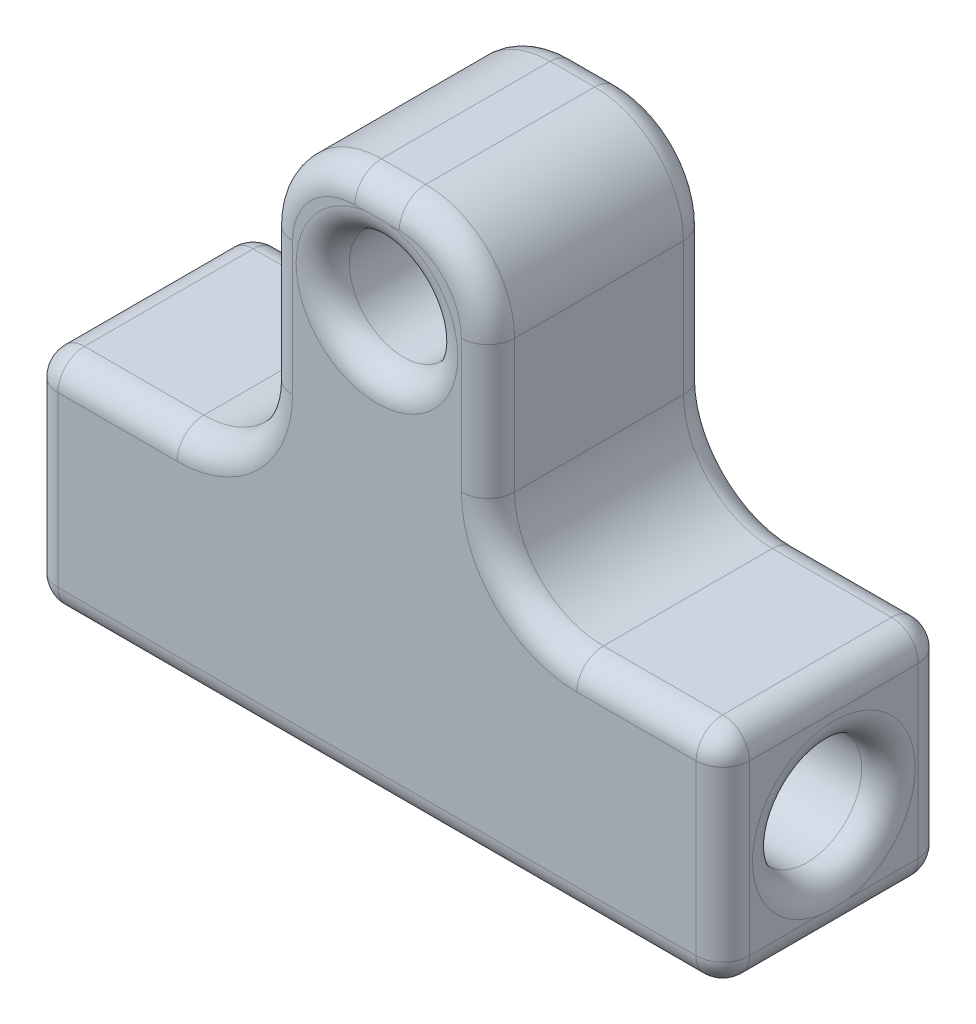
from build123d import *

# Parameters (mm, degrees)
SKETCH1_R           = 6.1
BOSS_EXTRUDE1_DEPTH = 25
SKETCH2_R           = 6.15
CUT_EXTRUDE1_DEPTH  = 88.09658729287669
FILLET1_R           = 3


with BuildPart() as part:
    # Sketch1 → Boss-Extrude1 (new body)
    with BuildSketch(Plane.XY):
        with BuildLine():
            Line((22.500000000000078, -5.000000000000004), (38.925619834710695, -5.000000000000004))
            Line((38.925619834710695, -5.000000000000004), (38.925619834710695, -30.000000000000007))
            Line((38.925619834710695, -30.000000000000007), (-38.92561983471068, -30.000000000000007))
            Line((-38.92561983471068, -30.000000000000007), (-38.92561983471068, -5.000000000000004))
            Line((-38.92561983471068, -5.000000000000004), (-22.500000000000068, -5.000000000000004))
            ThreePointArc((-22.500000000000068, -5.000000000000004), (-15.42893218813452, -2.0710678118654817), (-12.499999999999995, 5.000000000000067))
            Line((-12.499999999999995, 5.000000000000067), (-12.499999999999998, 19.99999999999993))
            ThreePointArc((-12.499999999999998, 19.99999999999993), (-9.571067811865476, 27.071067811865476), (-2.4999999999999294, 30))
            Line((-2.4999999999999294, 30), (2.499999999999931, 30))
            ThreePointArc((2.499999999999931, 30), (9.571067811865479, 27.071067811865476), (12.500000000000002, 19.99999999999993))
            Line((12.500000000000002, 19.99999999999993), (12.500000000000005, 5.000000000000065))
            ThreePointArc((12.500000000000005, 5.000000000000065), (15.428932188134532, -2.0710678118654826), (22.500000000000078, -5.000000000000004))
        make_face()
        with Locations((3.04e-15, 18)):
            Circle(SKETCH1_R, mode=Mode.SUBTRACT)
    extrude(amount=BOSS_EXTRUDE1_DEPTH)

    # Sketch2 → Cut-Extrude1 (cut, through all)
    with BuildSketch(Plane(origin=(38.925619834710695, 0, 0), x_dir=(0, 0, -1), z_dir=(1, 0, 0))):
        with Locations((-12.499999999999998, -18.000000000000007)):
            Circle(SKETCH2_R)
    extrude(amount=-CUT_EXTRUDE1_DEPTH, mode=Mode.SUBTRACT)

    # Fillet1
    # the kernel refuses this fillet: 3 mm, written as the material it takes off along each edge
    with BuildSketch(Plane(origin=(-35.92561983471068, -8.000000000000004, 22), x_dir=(0, 1, 0), z_dir=(-1, 0, 0))) as fillet1_piece_1_section:
        Polygon((0, 0), (FILLET1_R, 0), (FILLET1_R, -FILLET1_R), (0, -FILLET1_R), align=None)
    fillet1_piece_1 = extrude(amount=FILLET1_R, mode=Mode.PRIVATE)
    fillet1_piece_1 = fillet1_piece_1 - Plane(origin=(-35.92561983471068, -8.000000000000004, 22), x_dir=(0, -0.7071067811865475, -0.7071067811865475), z_dir=(-1, 0, 0)) * Sphere(FILLET1_R, mode=Mode.PRIVATE)
    add(fillet1_piece_1, mode=Mode.SUBTRACT)
    with BuildSketch(Plane(origin=(35.925619834710695, -8.000000000000004, 3), x_dir=(1, 0, 0), z_dir=(0, 1, 0))) as fillet1_piece_2_section:
        Polygon((0, 0), (FILLET1_R, 0), (FILLET1_R, FILLET1_R), (0, FILLET1_R), align=None)
    fillet1_piece_2 = extrude(amount=FILLET1_R, mode=Mode.PRIVATE)
    fillet1_piece_2 = fillet1_piece_2 - Plane(origin=(35.925619834710695, -8.000000000000004, 3), x_dir=(-0.7071067811865475, 0, 0.7071067811865475), z_dir=(0, 1, 0)) * Sphere(FILLET1_R, mode=Mode.PRIVATE)
    add(fillet1_piece_2, mode=Mode.SUBTRACT)
    with BuildSketch(Plane(origin=(-35.92561983471068, -27.000000000000007, 22), x_dir=(0, 0, 1), z_dir=(-1, 0, 0))) as fillet1_piece_3_section:
        Polygon((0, 0), (FILLET1_R, 0), (FILLET1_R, -FILLET1_R), (0, -FILLET1_R), align=None)
    fillet1_piece_3 = extrude(amount=FILLET1_R, mode=Mode.PRIVATE)
    fillet1_piece_3 = fillet1_piece_3 - Plane(origin=(-35.92561983471068, -27.000000000000007, 22), x_dir=(0, 0.7071067811865475, -0.7071067811865475), z_dir=(-1, 0, 0)) * Sphere(FILLET1_R, mode=Mode.PRIVATE)
    add(fillet1_piece_3, mode=Mode.SUBTRACT)
    with BuildSketch(Plane(origin=(35.925619834710695, -27.000000000000007, 3), x_dir=(0, 0, -1), z_dir=(1, 0, 0))) as fillet1_piece_4_section:
        Polygon((0, 0), (FILLET1_R, 0), (FILLET1_R, -FILLET1_R), (0, -FILLET1_R), align=None)
    fillet1_piece_4 = extrude(amount=FILLET1_R, mode=Mode.PRIVATE)
    fillet1_piece_4 = fillet1_piece_4 - Plane(origin=(35.925619834710695, -27.000000000000007, 3), x_dir=(0, 0.7071067811865475, 0.7071067811865475), z_dir=(1, 0, 0)) * Sphere(FILLET1_R, mode=Mode.PRIVATE)
    add(fillet1_piece_4, mode=Mode.SUBTRACT)
    with BuildSketch(Plane(origin=(-35.92561983471068, -27.000000000000007, 3), x_dir=(0, 0, -1), z_dir=(-1, 0, 0))) as fillet1_piece_5_section:
        Polygon((0, 0), (FILLET1_R, 0), (FILLET1_R, FILLET1_R), (0, FILLET1_R), align=None)
    fillet1_piece_5 = extrude(amount=FILLET1_R, mode=Mode.PRIVATE)
    fillet1_piece_5 = fillet1_piece_5 - Plane(origin=(-35.92561983471068, -27.000000000000007, 3), x_dir=(0, 0.7071067811865475, 0.7071067811865475), z_dir=(-1, 0, 0)) * Sphere(FILLET1_R, mode=Mode.PRIVATE)
    add(fillet1_piece_5, mode=Mode.SUBTRACT)
    with BuildSketch(Plane(origin=(-35.92561983471068, -8.000000000000004, 3), x_dir=(0, 1, 0), z_dir=(-1, 0, 0))) as fillet1_piece_6_section:
        Polygon((0, 0), (FILLET1_R, 0), (FILLET1_R, FILLET1_R), (0, FILLET1_R), align=None)
    fillet1_piece_6 = extrude(amount=FILLET1_R, mode=Mode.PRIVATE)
    fillet1_piece_6 = fillet1_piece_6 - Plane(origin=(-35.92561983471068, -8.000000000000004, 3), x_dir=(0, -0.7071067811865475, 0.7071067811865475), z_dir=(-1, 0, 0)) * Sphere(FILLET1_R, mode=Mode.PRIVATE)
    add(fillet1_piece_6, mode=Mode.SUBTRACT)
    with BuildSketch(Plane(origin=(35.925619834710695, -27.000000000000007, 22), x_dir=(0, 0, 1), z_dir=(1, 0, 0))) as fillet1_piece_7_section:
        Polygon((0, 0), (FILLET1_R, 0), (FILLET1_R, FILLET1_R), (0, FILLET1_R), align=None)
    fillet1_piece_7 = extrude(amount=FILLET1_R, mode=Mode.PRIVATE)
    fillet1_piece_7 = fillet1_piece_7 - Plane(origin=(35.925619834710695, -27.000000000000007, 22), x_dir=(0, 0.7071067811865475, -0.7071067811865475), z_dir=(1, 0, 0)) * Sphere(FILLET1_R, mode=Mode.PRIVATE)
    add(fillet1_piece_7, mode=Mode.SUBTRACT)
    with BuildSketch(Plane(origin=(35.925619834710695, -8.000000000000004, 22), x_dir=(1, 0, 0), z_dir=(0, 1, 0))) as fillet1_piece_8_section:
        Polygon((0, 0), (FILLET1_R, 0), (FILLET1_R, -FILLET1_R), (0, -FILLET1_R), align=None)
    fillet1_piece_8 = extrude(amount=FILLET1_R, mode=Mode.PRIVATE)
    fillet1_piece_8 = fillet1_piece_8 - Plane(origin=(35.925619834710695, -8.000000000000004, 22), x_dir=(-0.7071067811865475, 0, -0.7071067811865475), z_dir=(0, 1, 0)) * Sphere(FILLET1_R, mode=Mode.PRIVATE)
    add(fillet1_piece_8, mode=Mode.SUBTRACT)
    with BuildSketch(Plane(origin=(-35.92561983471068, -5.000000000000004, 25), x_dir=(0, -1, 0), z_dir=(1, 0, 0))) as fillet1_piece_9:
        with BuildLine():
            CenterArc((FILLET1_R, FILLET1_R), FILLET1_R, 180, 90)
            Line((-8.9e-16, FILLET1_R), (0, 0))
            Line((0, 0), (FILLET1_R, 0))
        make_face()
    extrude(amount=13.425619834710613, mode=Mode.SUBTRACT)
    with BuildSketch(Plane(origin=(-2.499999999999999, 20, 0), x_dir=(-1, -7.11e-15, 0), z_dir=(7.11e-15, -1, 0))) as fillet1_piece_10:
        with BuildLine():
            CenterArc((10 - FILLET1_R, -FILLET1_R), FILLET1_R, 8.48e-15, 90)
            Line((10, -FILLET1_R), (10, 0))
            Line((10, 0), (10 - FILLET1_R, 0))
        make_face()
    revolve(axis=Axis((-2.499999999999999, 20, 0), (0, 0, -1)), revolution_arc=90.00000000000081, mode=Mode.SUBTRACT)
    with BuildSketch(Plane(origin=(-2.4999999999999294, 30, 0), x_dir=(0, -1, 0), z_dir=(1, 0, 0))) as fillet1_piece_11:
        with BuildLine():
            CenterArc((FILLET1_R, -FILLET1_R), FILLET1_R, 90, 90)
            Line((0, -FILLET1_R), (0, 0))
            Line((0, 0), (FILLET1_R, 0))
        make_face()
    extrude(amount=4.999999999999861, mode=Mode.SUBTRACT)
    with BuildSketch(Plane(origin=(2.500000000000006, 20.000000000000007, 0), x_dir=(-7.51e-15, 1, 0), z_dir=(-1, -7.51e-15, 0))) as fillet1_piece_12:
        with BuildLine():
            CenterArc((9.999999999999993 - FILLET1_R, -FILLET1_R), FILLET1_R, 8.48e-15, 90)
            Line((9.999999999999993, -FILLET1_R), (9.999999999999993, 0))
            Line((9.999999999999993, 0), (9.999999999999993 - FILLET1_R, 0))
        make_face()
    revolve(axis=Axis((2.500000000000006, 20.000000000000007, 0), (0, 0, -1)), revolution_arc=90.00000000000088, mode=Mode.SUBTRACT)
    with BuildSketch(Plane(origin=(12.500000000000002, 19.99999999999993, 0), x_dir=(-1, -2.4e-16, 0), z_dir=(2.4e-16, -1, 0))) as fillet1_piece_13:
        with BuildLine():
            CenterArc((FILLET1_R, -FILLET1_R), FILLET1_R, 90, 90)
            Line((0, -FILLET1_R), (0, 0))
            Line((0, 0), (FILLET1_R, 0))
        make_face()
    extrude(amount=14.999999999999865, mode=Mode.SUBTRACT)
    with BuildSketch(Plane(origin=(22.500000000000004, 4.999999999999995, 0), x_dir=(-1, 7.02e-15, 0), z_dir=(7.02e-15, 1, 0))) as fillet1_piece_14:
        with BuildLine():
            CenterArc((9.999999999999998 + FILLET1_R, FILLET1_R), FILLET1_R, 180, 90)
            Line((9.999999999999998 + FILLET1_R, -4.4e-16), (9.999999999999998, 0))
            Line((9.999999999999998, 0), (9.999999999999998, FILLET1_R))
        make_face()
    revolve(axis=Axis((22.500000000000004, 4.999999999999995, 0), (0, 0, 1)), revolution_arc=90.00000000000082, mode=Mode.SUBTRACT)
    with BuildSketch(Plane(origin=(22.500000000000078, -5.000000000000004, 0), x_dir=(0, 3e-16, 1), z_dir=(1, 0, 0))) as fillet1_piece_15:
        with BuildLine():
            CenterArc((FILLET1_R, FILLET1_R), FILLET1_R, 180, 90)
            Line((-1.33e-15, FILLET1_R), (0, 0))
            Line((0, 0), (FILLET1_R, 0))
        make_face()
    extrude(amount=13.425619834710616, mode=Mode.SUBTRACT)
    with BuildSketch(Plane(origin=(-38.92561983471068, -27.000000000000007, 25), x_dir=(1, 0, 0), z_dir=(0, 1, 0))) as fillet1_piece_16:
        with BuildLine():
            CenterArc((FILLET1_R, FILLET1_R), FILLET1_R, 180, 90)
            Line((0, FILLET1_R), (0, 0))
            Line((0, 0), (FILLET1_R, 0))
        make_face()
    extrude(amount=19.000000000000004, mode=Mode.SUBTRACT)
    with BuildSketch(Plane(origin=(38.925619834710695, -8.000000000000004, 0), x_dir=(0, 0, 1), z_dir=(0, -1, 0))) as fillet1_piece_17:
        with BuildLine():
            CenterArc((FILLET1_R, FILLET1_R), FILLET1_R, 180, 90)
            Line((-4.4e-16, FILLET1_R), (0, 0))
            Line((0, 0), (FILLET1_R, 0))
        make_face()
    extrude(amount=19.000000000000004, mode=Mode.SUBTRACT)
    with BuildSketch(Plane(origin=(35.925619834710695, -30.000000000000007, 0), x_dir=(0, 1, 0), z_dir=(-1, 0, 0))) as fillet1_piece_18:
        with BuildLine():
            CenterArc((FILLET1_R, -FILLET1_R), FILLET1_R, 90, 90)
            Line((0, -FILLET1_R), (0, 0))
            Line((0, 0), (FILLET1_R, 0))
        make_face()
    extrude(amount=71.85123966942137, mode=Mode.SUBTRACT)
    with BuildSketch(Plane(origin=(-38.92561983471068, -27.000000000000007, 0), x_dir=(1, 0, 0), z_dir=(0, 1, 0))) as fillet1_piece_19:
        with BuildLine():
            CenterArc((FILLET1_R, -FILLET1_R), FILLET1_R, 90, 90)
            Line((0, -FILLET1_R), (0, 0))
            Line((0, 0), (FILLET1_R, 0))
        make_face()
    extrude(amount=19.000000000000004, mode=Mode.SUBTRACT)
    with BuildSketch(Plane(origin=(-35.92561983471068, -5.000000000000004, 0), x_dir=(0, -1, 0), z_dir=(1, 0, 0))) as fillet1_piece_20:
        with BuildLine():
            CenterArc((FILLET1_R, -FILLET1_R), FILLET1_R, 90, 90)
            Line((-8.9e-16, -FILLET1_R), (0, 0))
            Line((0, 0), (FILLET1_R, 0))
        make_face()
    extrude(amount=13.425619834710613, mode=Mode.SUBTRACT)
    with BuildSketch(Plane(origin=(-22.499999999999993, 4.999999999999993, 0), x_dir=(-7.46e-15, -1, 0), z_dir=(-1, 7.46e-15, 0))) as fillet1_piece_21:
        with BuildLine():
            CenterArc((9.999999999999998 + FILLET1_R, FILLET1_R), FILLET1_R, 180, 90)
            Line((9.999999999999998, FILLET1_R), (9.999999999999998, 0))
            Line((9.999999999999998, 0), (9.999999999999998 + FILLET1_R, 0))
        make_face()
    revolve(axis=Axis((-22.499999999999993, 4.999999999999993, 0), (0, 0, 1)), revolution_arc=90.00000000000085, mode=Mode.SUBTRACT)
    with BuildSketch(Plane(origin=(-12.499999999999995, 5.000000000000067, 0), x_dir=(1, 2.4e-16, 0), z_dir=(-2.4e-16, 1, 0))) as fillet1_piece_22:
        with BuildLine():
            CenterArc((FILLET1_R, -FILLET1_R), FILLET1_R, 90, 90)
            Line((0, -FILLET1_R), (0, 0))
            Line((0, 0), (FILLET1_R, 0))
        make_face()
    extrude(amount=14.999999999999861, mode=Mode.SUBTRACT)
    with BuildSketch(Plane(origin=(35.925619834710695, -30.000000000000007, 25), x_dir=(0, 1, 0), z_dir=(-1, 0, 0))) as fillet1_piece_23:
        with BuildLine():
            CenterArc((FILLET1_R, FILLET1_R), FILLET1_R, 180, 90)
            Line((0, FILLET1_R), (0, 0))
            Line((0, 0), (FILLET1_R, 0))
        make_face()
    extrude(amount=71.85123966942137, mode=Mode.SUBTRACT)
    with BuildSketch(Plane(origin=(38.925619834710695, -8.000000000000004, 25), x_dir=(0, 0, -1), z_dir=(0, -1, 0))) as fillet1_piece_24:
        with BuildLine():
            CenterArc((FILLET1_R, -FILLET1_R), FILLET1_R, 90, 90)
            Line((0, -FILLET1_R), (0, 0))
            Line((0, 0), (FILLET1_R, 0))
        make_face()
    extrude(amount=19.000000000000004, mode=Mode.SUBTRACT)
    with BuildSketch(Plane(origin=(38.925619834710695, -5.000000000000004, 3), x_dir=(-1, 3e-16, 0), z_dir=(0, 0, 1))) as fillet1_piece_25:
        with BuildLine():
            CenterArc((FILLET1_R, FILLET1_R), FILLET1_R, 180, 90)
            Line((-8.9e-16, FILLET1_R), (0, 0))
            Line((0, 0), (FILLET1_R, 0))
        make_face()
    extrude(amount=19, mode=Mode.SUBTRACT)
    with BuildSketch(Plane(origin=(38.925619834710695, -30.000000000000007, 3), x_dir=(0, 1, 0), z_dir=(0, 0, 1))) as fillet1_piece_26:
        with BuildLine():
            CenterArc((FILLET1_R, FILLET1_R), FILLET1_R, 180, 90)
            Line((0, FILLET1_R), (0, 0))
            Line((0, 0), (FILLET1_R, 0))
        make_face()
    extrude(amount=19, mode=Mode.SUBTRACT)
    with BuildSketch(Plane(origin=(-38.92561983471068, -30.000000000000007, 3), x_dir=(1, 0, 0), z_dir=(0, 0, 1))) as fillet1_piece_27:
        with BuildLine():
            CenterArc((FILLET1_R, FILLET1_R), FILLET1_R, 180, 90)
            Line((0, FILLET1_R), (0, 0))
            Line((0, 0), (FILLET1_R, 0))
        make_face()
    extrude(amount=19, mode=Mode.SUBTRACT)
    with BuildSketch(Plane(origin=(-38.92561983471068, -5.000000000000004, 3), x_dir=(0, -1, 0), z_dir=(0, 0, 1))) as fillet1_piece_28:
        with BuildLine():
            CenterArc((FILLET1_R, FILLET1_R), FILLET1_R, 180, 90)
            Line((-8.9e-16, FILLET1_R), (0, 0))
            Line((0, 0), (FILLET1_R, 0))
        make_face()
    extrude(amount=19, mode=Mode.SUBTRACT)
    with BuildSketch(Plane(origin=(22.500000000000078, -5.000000000000004, 25), x_dir=(0, 3e-16, -1), z_dir=(1, 0, 0))) as fillet1_piece_29:
        with BuildLine():
            CenterArc((FILLET1_R, -FILLET1_R), FILLET1_R, 89.99999999999999, 90.00000000000001)
            Line((-8.9e-16, -FILLET1_R), (0, 0))
            Line((0, 0), (FILLET1_R, 0))
        make_face()
    extrude(amount=13.425619834710616, mode=Mode.SUBTRACT)
    with BuildSketch(Plane(origin=(22.500000000000004, 4.999999999999995, 25), x_dir=(-1, 7.02e-15, 0), z_dir=(7.02e-15, 1, 0))) as fillet1_piece_30:
        with BuildLine():
            CenterArc((9.999999999999998 + FILLET1_R, -FILLET1_R), FILLET1_R, 90, 90)
            Line((9.999999999999998 + FILLET1_R, 0), (9.999999999999998, 0))
            Line((9.999999999999998, 0), (9.999999999999998, -FILLET1_R))
        make_face()
    revolve(axis=Axis((22.500000000000004, 4.999999999999995, 25), (0, 0, 1)), revolution_arc=90.00000000000082, mode=Mode.SUBTRACT)
    with BuildSketch(Plane(origin=(12.500000000000002, 19.99999999999993, 25), x_dir=(-1, -2.4e-16, 0), z_dir=(2.4e-16, -1, 0))) as fillet1_piece_31:
        with BuildLine():
            CenterArc((FILLET1_R, FILLET1_R), FILLET1_R, 180, 90)
            Line((0, FILLET1_R), (0, 0))
            Line((0, 0), (FILLET1_R, 0))
        make_face()
    extrude(amount=14.999999999999865, mode=Mode.SUBTRACT)
    with BuildSketch(Plane(origin=(3.04e-15, 18, 0), x_dir=(1, 0, 0), z_dir=(0, -1, 0))) as fillet1_piece_32:
        with BuildLine():
            CenterArc((6.1 + FILLET1_R, FILLET1_R), FILLET1_R, 180, 90)
            Line((6.099999999999999, FILLET1_R), (6.1, 0))
            Line((6.1, 0), (6.1 + FILLET1_R, 0))
        make_face()
    revolve(axis=Axis((3.04e-15, 18, 0), (0, 0, 1)), mode=Mode.SUBTRACT)
    with BuildSketch(Plane(origin=(3.04e-15, 18, 25), x_dir=(1, 0, 0), z_dir=(0, -1, 0))) as fillet1_piece_33:
        with BuildLine():
            CenterArc((6.1 + FILLET1_R, -FILLET1_R), FILLET1_R, 90, 90)
            Line((6.099999999999999, -FILLET1_R), (6.1, 0))
            Line((6.1, 0), (6.1 + FILLET1_R, 0))
        make_face()
    revolve(axis=Axis((3.04e-15, 18, 25), (0, 0, 1)), mode=Mode.SUBTRACT)
    with BuildSketch(Plane(origin=(2.500000000000006, 20.000000000000007, 25), x_dir=(-7.51e-15, 1, 0), z_dir=(-1, -7.51e-15, 0))) as fillet1_piece_34:
        with BuildLine():
            CenterArc((9.999999999999993 - FILLET1_R, FILLET1_R), FILLET1_R, 270, 90)
            Line((9.999999999999993, FILLET1_R), (9.999999999999993, 0))
            Line((9.999999999999993, 0), (9.999999999999993 - FILLET1_R, 0))
        make_face()
    revolve(axis=Axis((2.500000000000006, 20.000000000000007, 25), (0, 0, -1)), revolution_arc=90.00000000000088, mode=Mode.SUBTRACT)
    with BuildSketch(Plane(origin=(-2.4999999999999294, 30, 25), x_dir=(0, -1, 0), z_dir=(1, 0, 0))) as fillet1_piece_35:
        with BuildLine():
            CenterArc((FILLET1_R, FILLET1_R), FILLET1_R, 180, 90)
            Line((0, FILLET1_R), (0, 0))
            Line((0, 0), (FILLET1_R, 0))
        make_face()
    extrude(amount=4.999999999999861, mode=Mode.SUBTRACT)
    with BuildSketch(Plane(origin=(-2.499999999999999, 20, 25), x_dir=(-1, -7.11e-15, 0), z_dir=(7.11e-15, -1, 0))) as fillet1_piece_36:
        with BuildLine():
            CenterArc((10 - FILLET1_R, FILLET1_R), FILLET1_R, 270, 90)
            Line((10, FILLET1_R), (10, 0))
            Line((10, 0), (10 - FILLET1_R, 0))
        make_face()
    revolve(axis=Axis((-2.499999999999999, 20, 25), (0, 0, -1)), revolution_arc=90.00000000000081, mode=Mode.SUBTRACT)
    with BuildSketch(Plane(origin=(-38.92561983471068, -18.000000000000007, 12.499999999999998), x_dir=(0, 0, -1), z_dir=(0, -1, 0))) as fillet1_piece_37:
        with BuildLine():
            CenterArc((6.15 + FILLET1_R, FILLET1_R), FILLET1_R, 180, 90)
            Line((6.15 + FILLET1_R, 0), (6.15, 0))
            Line((6.15, 0), (6.15, FILLET1_R))
        make_face()
    revolve(axis=Axis((-38.92561983471068, -18.000000000000007, 12.499999999999998), (1, 0, 0)), mode=Mode.SUBTRACT)
    with BuildSketch(Plane(origin=(38.925619834710695, -18.000000000000007, 12.499999999999998), x_dir=(0, 0, -1), z_dir=(0, -1, 0))) as fillet1_piece_38:
        with BuildLine():
            CenterArc((6.15 + FILLET1_R, -FILLET1_R), FILLET1_R, 90, 90)
            Line((6.15, -FILLET1_R), (6.15, 0))
            Line((6.15, 0), (6.15 + FILLET1_R, 0))
        make_face()
    revolve(axis=Axis((38.925619834710695, -18.000000000000007, 12.499999999999998), (1, 0, 0)), mode=Mode.SUBTRACT)
    with BuildSketch(Plane(origin=(-12.499999999999995, 5.000000000000067, 25), x_dir=(1, 2.4e-16, 0), z_dir=(-2.4e-16, 1, 0))) as fillet1_piece_39:
        with BuildLine():
            CenterArc((FILLET1_R, FILLET1_R), FILLET1_R, 180, 90)
            Line((0, FILLET1_R), (0, 0))
            Line((0, 0), (FILLET1_R, 0))
        make_face()
    extrude(amount=14.999999999999861, mode=Mode.SUBTRACT)
    with BuildSketch(Plane(origin=(-22.499999999999993, 4.999999999999993, 25), x_dir=(-7.46e-15, -1, 0), z_dir=(-1, 7.46e-15, 0))) as fillet1_piece_40:
        with BuildLine():
            CenterArc((9.999999999999998 + FILLET1_R, -FILLET1_R), FILLET1_R, 90, 90)
            Line((9.999999999999998, -FILLET1_R), (9.999999999999998, 0))
            Line((9.999999999999998, 0), (9.999999999999998 + FILLET1_R, 0))
        make_face()
    revolve(axis=Axis((-22.499999999999993, 4.999999999999993, 25), (0, 0, 1)), revolution_arc=90.00000000000085, mode=Mode.SUBTRACT)


solid = part.part
